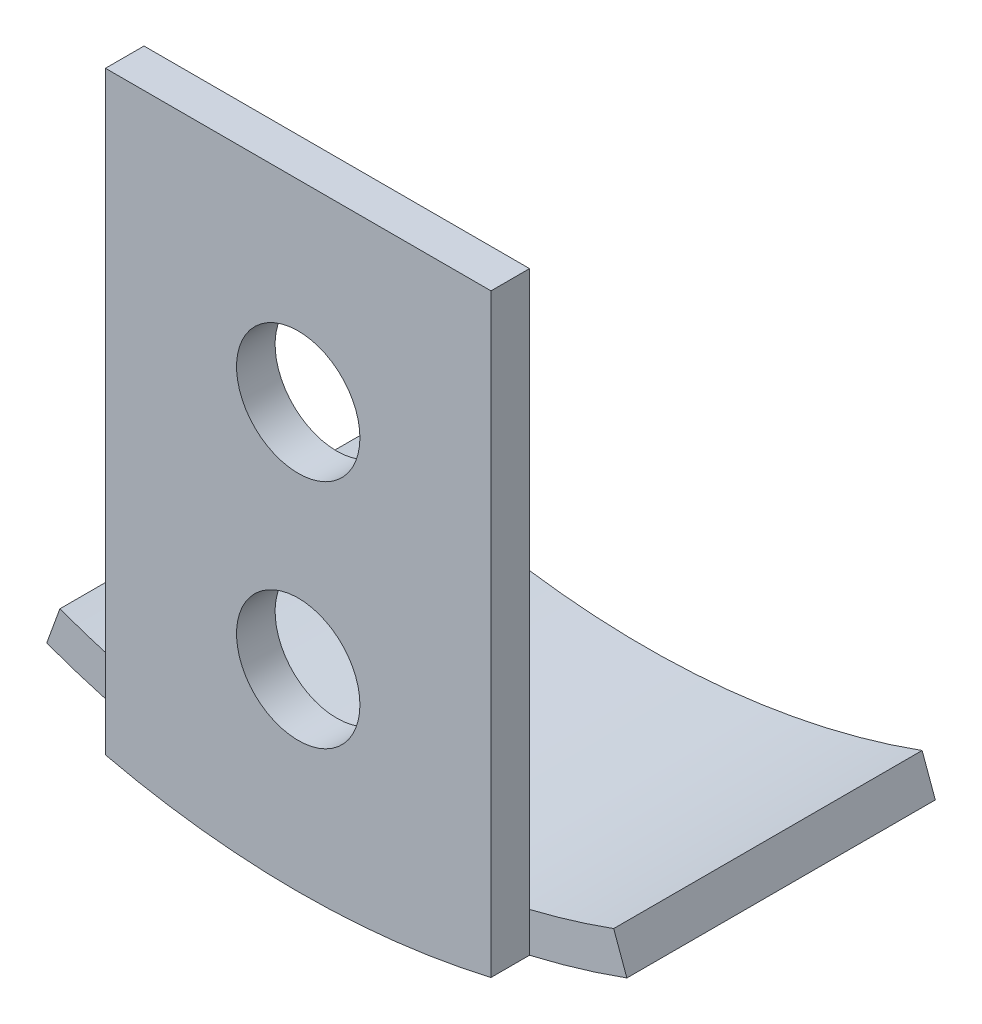
from build123d import *

# Parameters (mm, degrees)
EXTRUDE_1_DEPTH     = 10
SKETCH_2_R          = 1.6
CUT_EXTRUDE_1_DEPTH = 20.798989873
SKETCH_4_W          = 10
SKETCH_4_H          = 5
CUT_EXTRUDE_2_DEPTH = 20
EXTRUDE_2_DEPTH     = 8
CUT_EXTRUDE_START   = -1
CUT_EXTRUDE_3_DEPTH = 1


# Read off the part's stored shape, not the designer's step: 除料-伸長3
with BuildPart() as part:
    # 草圖1 → 填料-伸長1 (new body)
    with BuildSketch(Plane(origin=(0, 0, 0), x_dir=(0, 0, -1), z_dir=(1, 0, 0))):
        Polygon((0, 0), (6, 0), (6, 1), (1, 1), (1, 16), (0, 16), align=None)
    extrude(amount=EXTRUDE_1_DEPTH)

    # 草圖2 → 除料-伸長1 (cut, through all)
    with BuildSketch(Plane.XY):
        with Locations((5, 11)):
            Circle(SKETCH_2_R)
        with Locations((5, 5)):
            Circle(SKETCH_2_R)
    extrude(amount=-CUT_EXTRUDE_1_DEPTH, mode=Mode.SUBTRACT)

    # 草圖4 → 除料-伸長2 (cut, through all)
    with BuildSketch(Plane(origin=(0, 1, 0), x_dir=(1, 0, 0), z_dir=(0, 1, 0))):
        with Locations((5, 3.5)):
            Rectangle(SKETCH_4_W, SKETCH_4_H)
    extrude(amount=-CUT_EXTRUDE_2_DEPTH, mode=Mode.SUBTRACT)

    # 草圖5 → 填料-伸長2 (add)
    with BuildSketch(Plane(origin=(0, 0, -1), x_dir=(-1, 0, 0), z_dir=(0, 0, -1))):
        with BuildLine():
            Line((2.524443153, 1.326762343), (2.18242301, 2.266454963))
            ThreePointArc((2.18242301, 2.266454963), (-5, 1), (-12.18242301, 2.266454963))
            Line((-12.18242301, 2.266454963), (-12.524443153, 1.326762343))
            ThreePointArc((-12.524443153, 1.326762343), (-5, 0), (2.524443153, 1.326762343))
        make_face()
    extrude(amount=EXTRUDE_2_DEPTH)

    # 除料-伸長3 outline → 除料-伸長3 (cut)
    with BuildSketch(Plane(origin=(0, 0, -1), x_dir=(-1, 0, 0), z_dir=(0, 0, -1)).offset(CUT_EXTRUDE_START)):
        with BuildLine():
            Line((0, 0), (0, 0.575714714))
            ThreePointArc((0, 0.575714714), (-2.483482164, 0.144402594), (-4.999999936, 0))
            Line((-4.999999936, 0), (0, 0))
        make_face()
        with BuildLine():
            Line((-10, 0), (-4.999999936, 0))
            ThreePointArc((-4.999999936, 0), (-7.516517772, 0.144402587), (-10, 0.575714714))
            Line((-10, 0.575714714), (-10, 0))
        make_face()
    extrude(amount=CUT_EXTRUDE_3_DEPTH, mode=Mode.SUBTRACT)


solid = part.part
